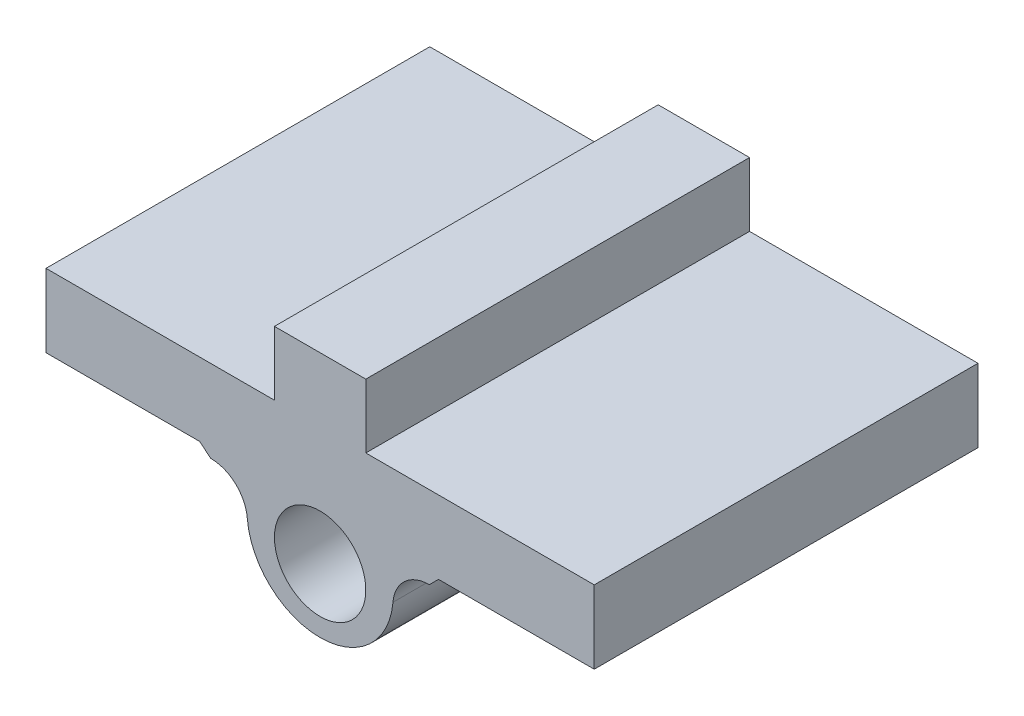
from build123d import *

# Parameters (mm, degrees)
SKETCH1_W           = 60
SKETCH1_H           = 42
BOSS_EXTRUDE1_DEPTH = 8
SKETCH3_W           = 10
SKETCH3_H           = 42
BOSS_EXTRUDE5_DEPTH = 7
SKETCH5_W           = 14
SKETCH5_H           = 42
BOSS_EXTRUDE6_DEPTH = 11
SKETCH6_R           = 5
CUT_EXTRUDE1_DEPTH  = 75.759614766
FILLET1_R           = 7
FILLET2_R           = 5
FILLET3_R           = 5
BOSS_EXTRUDE7_DEPTH = 42


with BuildPart() as part:
    # Sketch1 → Boss-Extrude1 (new body)
    with BuildSketch(Plane(origin=(0, 0, 0), x_dir=(1, 0, 0), z_dir=(0, 1, 0))):
        with Locations((30, 21)):
            Rectangle(SKETCH1_W, SKETCH1_H)
    extrude(amount=BOSS_EXTRUDE1_DEPTH)

    # Sketch3 → Boss-Extrude5 (add)
    with BuildSketch(Plane(origin=(0, 8, 0), x_dir=(1, 0, 0), z_dir=(0, 1, 0))):
        with Locations((30, 21)):
            Rectangle(SKETCH3_W, SKETCH3_H)
    extrude(amount=BOSS_EXTRUDE5_DEPTH)

    # Sketch5 → Boss-Extrude6 (add)
    with BuildSketch(Plane.XZ):
        with Locations((30, -21)):
            Rectangle(SKETCH5_W, SKETCH5_H)
    extrude(amount=BOSS_EXTRUDE6_DEPTH)

    # Sketch6 → Cut-Extrude1 (cut, through all)
    with BuildSketch(Plane(origin=(0, 0, -42), x_dir=(-1, 0, 0), z_dir=(0, 0, -1))):
        with Locations((-30, -5)):
            Circle(SKETCH6_R)
    extrude(amount=-CUT_EXTRUDE1_DEPTH, mode=Mode.SUBTRACT)

    # Fillet1
    fillet1_edges = [part.edges().sort_by_distance(p)[0] for p in [
        (23, -11, -21),
        (37, -11, -21),
    ]]
    fillet(fillet1_edges, radius=FILLET1_R - 0.0001)  # a hair under: the kernel refuses the full size

    # Fillet2
    fillet2_edges = [part.edges().sort_by_distance(p)[0] for p in [
        (23, 0, -21),
    ]]
    fillet(fillet2_edges, radius=FILLET2_R)

    # Fillet3
    fillet3_edges = [part.edges().sort_by_distance(p)[0] for p in [
        (37, 0, -21),
    ]]
    fillet(fillet3_edges, radius=FILLET3_R)

    # Sketch8 → Boss-Extrude7 (add)
    with BuildSketch(Plane(origin=(0, 0, -42), x_dir=(-1, 0, 0), z_dir=(0, 0, -1))):
        with BuildLine():
            Line((-41.958260743, -1), (-42.958260743, 0))
            Line((-42.958260743, 0), (-41.958260743, 0))
            ThreePointArc((-41.958260743, 0), (-38.573244741, -1.320099639), (-36.9756521, -4.583333333))
            ThreePointArc((-36.9756521, -4.583333333), (-34.739022403, -9.151860505), (-30, -11))
            ThreePointArc((-30, -11), (-25.260977597, -9.151860505), (-23.0243479, -4.583333333))
            ThreePointArc((-23.0243479, -4.583333333), (-21.426755259, -1.320099639), (-18.041739257, 0))
            Line((-18.041739257, 0), (-16.803044796, 0))
            Line((-16.803044796, 0), (-18.041739257, -1))
            ThreePointArc((-18.041739257, -1), (-20.749752058, -2.056079711), (-22.027826171, -4.666666667))
            ThreePointArc((-22.027826171, -4.666666667), (-24.583974397, -9.887840578), (-30, -12))
            ThreePointArc((-30, -12), (-35.416025603, -9.887840578), (-37.972173829, -4.666666667))
            ThreePointArc((-37.972173829, -4.666666667), (-39.250247942, -2.056079711), (-41.958260743, -1))
        make_face()
    extrude(amount=-BOSS_EXTRUDE7_DEPTH)


solid = part.part
